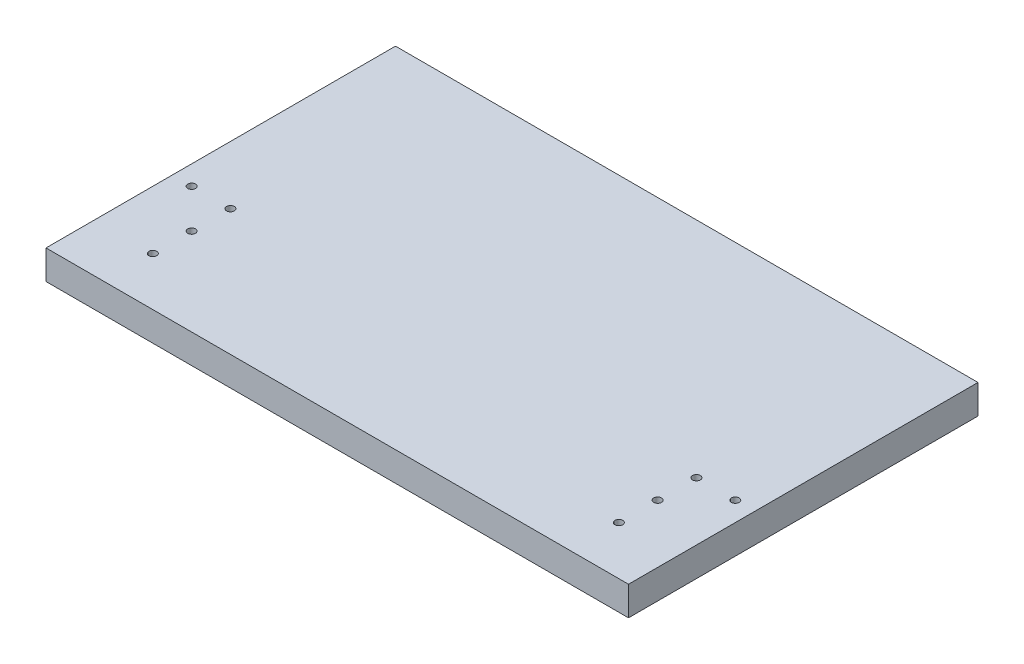
from build123d import *

# Parameters (mm, degrees)
CROQUIS1_W              = 300
CROQUIS1_H              = 180
SALIENTE_EXTRUIR1_DEPTH = 15
CROQUIS2_R              = 2
CORTAR_EXTRUIR1_DEPTH   = 10
CROQUIS3_R              = 2
CORTAR_EXTRUIR2_DEPTH   = 10


with BuildPart() as part:
    # Croquis1 → Saliente-Extruir1 (new body)
    with BuildSketch(Plane(origin=(0, 0, 0), x_dir=(1, 0, 0), z_dir=(0, 1, 0))):
        Rectangle(CROQUIS1_W, CROQUIS1_H)
    extrude(amount=SALIENTE_EXTRUIR1_DEPTH)

    # Croquis2 → Cortar-Extruir1 (cut)
    with BuildSketch(Plane(origin=(0, 15, 0), x_dir=(1, 0, 0), z_dir=(0, 1, 0))):
        with Locations((-120, -65)):
            Circle(CROQUIS2_R)
        with Locations((-120, -45)):
            Circle(CROQUIS2_R)
        with Locations((120, -65)):
            Circle(CROQUIS2_R)
        with Locations((120, -45)):
            Circle(CROQUIS2_R)
        with Locations((-140, -25)):
            Circle(CROQUIS2_R)
        with Locations((-120, -25)):
            Circle(CROQUIS2_R)
        with Locations((120, -25)):
            Circle(CROQUIS2_R)
        with Locations((140, -25)):
            Circle(CROQUIS2_R)
    extrude(amount=-CORTAR_EXTRUIR1_DEPTH, mode=Mode.SUBTRACT)

    # Croquis3 → Cortar-Extruir2 (cut)
    with BuildSketch(Plane.XZ):
        with Locations((-140, -65)):
            Circle(CROQUIS3_R)
    extrude(amount=-CORTAR_EXTRUIR2_DEPTH, mode=Mode.SUBTRACT)


solid = part.part
